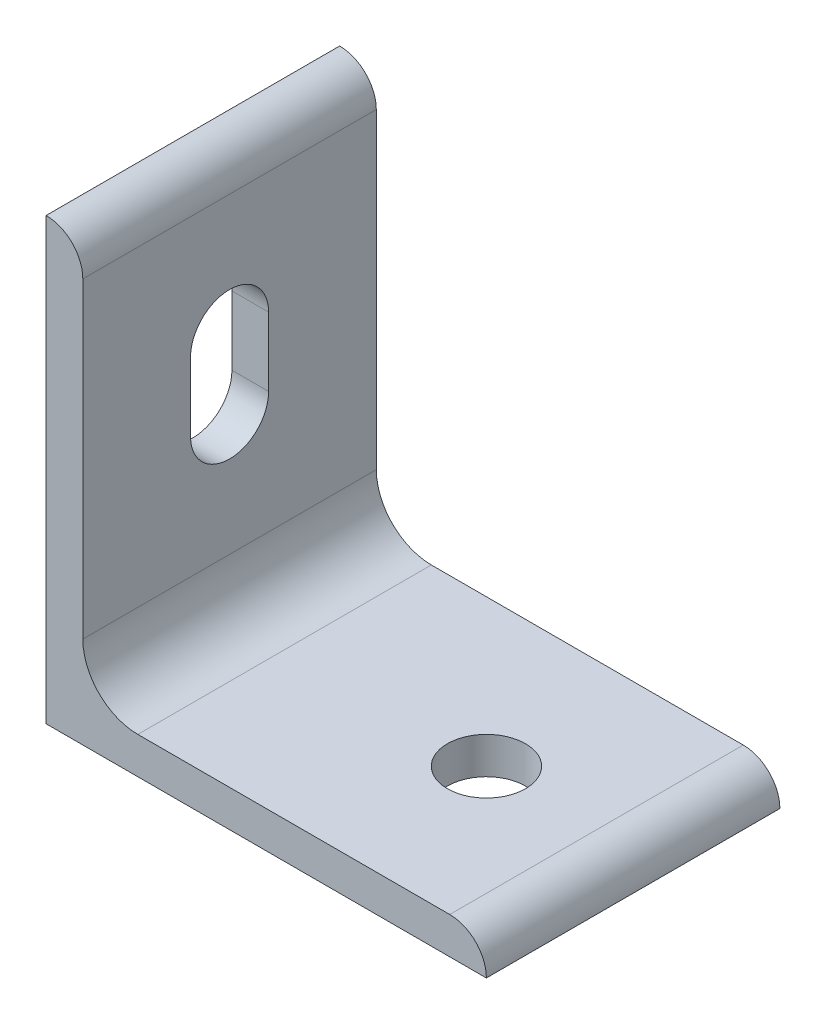
from build123d import *

# Parameters (mm, degrees)
BASESTEELANGLE_DEPTH        = 12.7
F_1_4_CLEARANCE_HOLE1_D     = 6.7564
F_1_4_CLEARANCE_SLOT1_DEPTH = 3.175


# Read off the part's stored shape, not the designer's step: 1/4 Clearance Slot1
with BuildPart() as part:
    # Sketch1 → BaseSteelAngle (new, symmetric)
    with BuildSketch(Plane.XY):
        with BuildLine():
            Line((0, 0), (0, 38.1))
            Line((0, 38.1), (0.00508, 38.1))
            ThreePointArc((0.00508, 38.1), (2.246551928, 37.171551928), (3.175, 34.93008))
            Line((3.175, 34.93008), (3.175, 7.9375))
            ThreePointArc((3.175, 7.9375), (4.569903955, 4.569903955), (7.9375, 3.175))
            Line((7.9375, 3.175), (34.93008, 3.175))
            ThreePointArc((34.93008, 3.175), (37.171551928, 2.246551928), (38.1, 0.00508))
            Line((38.1, 0.00508), (38.1, 0))
            Line((38.1, 0), (0, 0))
        make_face()
    extrude(amount=BASESTEELANGLE_DEPTH, both=True)

    # 1/4 Clearance Hole1 (through all)
    with Locations(Plane(origin=(25.40508, 3.175, 0), x_dir=(1, 0, 0), z_dir=(0, 1, 0))):
        with Locations((0, 0)):
            Hole(F_1_4_CLEARANCE_HOLE1_D / 2)

    # 1/4 Clearance Slot1 outline → 1/4 Clearance Slot1 (cut)
    with BuildSketch(Plane.YZ):
        with BuildLine():
            Line((24.40559, 3.3782), (18.46199, 3.3782))
            ThreePointArc((18.46199, 3.3782), (15.08379, 0), (18.46199, -3.3782))
            Line((18.46199, -3.3782), (24.40559, -3.3782))
            ThreePointArc((24.40559, -3.3782), (27.78379, 0), (24.40559, 3.3782))
        make_face()
    extrude(amount=F_1_4_CLEARANCE_SLOT1_DEPTH, mode=Mode.SUBTRACT)


solid = part.part
